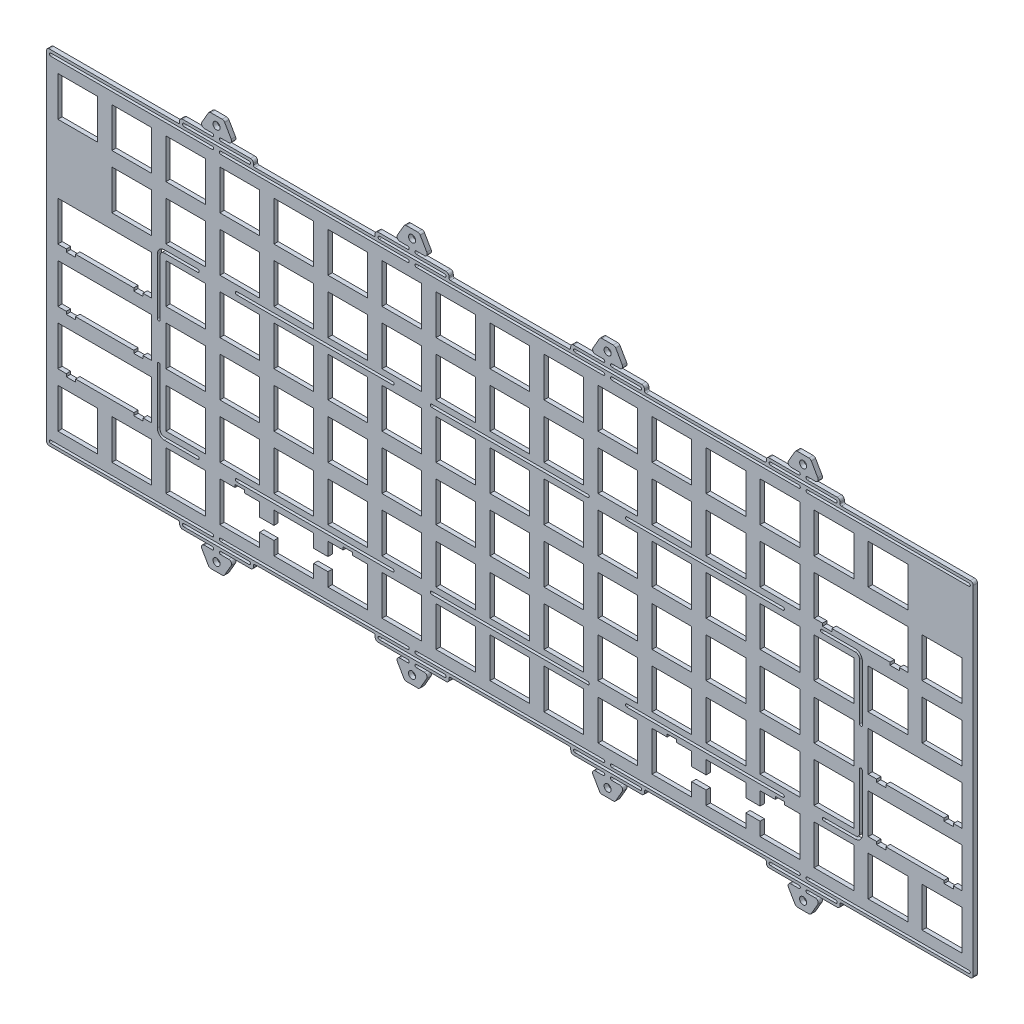
from build123d import *

# Parameters (mm, degrees)
SKETCH2_W                             = 344.79935
SKETCH2_H                             = 139.24936
SKETCH2_W_2                           = 13.999
SKETCH2_H_2                           = 14.00086
SKETCH2_W_3                           = 14.001
SKETCH2_W_4                           = 13.9993
SKETCH2_W_5                           = 13.99955
SKETCH2_H_3                           = 13.9994
SKETCH2_W_6                           = 14.0007
SKETCH2_H_4                           = 13.9993
SKETCH2_H_5                           = 13.9992
BOSS_EXTRUDE1_DEPTH                   = 1.524
SKETCH3_W                             = 388.73179045
SKETCH3_H                             = 165.989329794
CUT_EXTRUDE1_DEPTH                    = 186.935149558
TAP_DRILL_FOR_M3X0_5_TAP1_D           = 2.5
TAP_DRILL_FOR_M3X0_5_TAP1_DEPTH       = 7
TAP_DRILL_FOR_M3X0_5_TAP1_CSINK_D     = 2.55
TAP_DRILL_FOR_M3X0_5_TAP1_CSINK_ANGLE = 90
TAP_DRILL_FOR_M3X0_5_TAP1_TIP         = 0.751075774


with BuildPart() as part:
    # Sketch2 → Boss-Extrude1 (new body)
    with BuildSketch(Plane.XY):
        with Locations((-0.0007173, 0.0004735)):
            Rectangle(SKETCH2_W, SKETCH2_H)
        Polygon((102.2489577, -54.6242065), (102.2489577, -40.6233465), (96.8999577, -40.6233465), (96.8999577, -39.6545865), (93.5999577, -39.6545865), (93.5999577, -40.6233465), (88.2499577, -40.6233465), (88.2499577, -45.3238165), (83.1989577, -45.3238165), (83.1989577, -40.6233465), (69.1999577, -40.6233465), (69.1999577, -45.3238165), (64.1489577, -45.3238165), (64.1489577, -40.6233465), (58.8009577, -40.6233465), (58.8009577, -39.6545865), (55.4999577, -39.6545865), (55.4999577, -40.6233465), (50.1499577, -40.6233465), (50.1499577, -54.6242065), (64.1489577, -54.6242065), (64.1489577, -49.9223065), (69.1999577, -49.9223065), (69.1999577, -54.6242065), (83.1989577, -54.6242065), (83.1989577, -49.9223065), (88.2499577, -49.9223065), (88.2499577, -54.6242065), align=None, mode=Mode.SUBTRACT)
        Polygon((-50.1496423, -54.6242065), (-50.1496423, -40.6233465), (-55.4991423, -40.6233465), (-55.4991423, -39.6545865), (-58.7994423, -39.6545865), (-58.7994423, -40.6233465), (-64.1503423, -40.6233465), (-64.1503423, -45.3238165), (-69.2010423, -45.3238165), (-69.2010423, -40.6233465), (-83.2003423, -40.6233465), (-83.2003423, -45.3238165), (-88.2496423, -45.3238165), (-88.2496423, -40.6233465), (-93.6003423, -40.6233465), (-93.6003423, -39.6545865), (-96.9003423, -39.6545865), (-96.9003423, -40.6233465), (-102.2503423, -40.6233465), (-102.2503423, -54.6242065), (-88.2496423, -54.6242065), (-88.2496423, -49.9223065), (-83.2003423, -49.9223065), (-83.2003423, -54.6242065), (-69.2010423, -54.6242065), (-69.2010423, -49.9223065), (-64.1503423, -49.9223065), (-64.1503423, -54.6242065), align=None, mode=Mode.SUBTRACT)
        with Locations((152.3994577, -47.6237765)):
            Rectangle(SKETCH2_W_2, SKETCH2_H_2, mode=Mode.SUBTRACT)
        with Locations((133.3494577, -47.6237765)):
            Rectangle(SKETCH2_W_2, SKETCH2_H_2, mode=Mode.SUBTRACT)
        with Locations((114.2994577, -47.6237765)):
            Rectangle(SKETCH2_W_2, SKETCH2_H_2, mode=Mode.SUBTRACT)
        with Locations((38.0994577, -47.6237765)):
            Rectangle(SKETCH2_W_2, SKETCH2_H_2, mode=Mode.SUBTRACT)
        with Locations((19.0494577, -47.6237765)):
            Rectangle(SKETCH2_W_2, SKETCH2_H_2, mode=Mode.SUBTRACT)
        with Locations((-0.0005423, -47.6237765)):
            Rectangle(SKETCH2_W_2, SKETCH2_H_2, mode=Mode.SUBTRACT)
        with Locations((-19.0505423, -47.6237765)):
            Rectangle(SKETCH2_W_2, SKETCH2_H_2, mode=Mode.SUBTRACT)
        with Locations((-38.1015423, -47.6237765)):
            Rectangle(SKETCH2_W_3, SKETCH2_H_2, mode=Mode.SUBTRACT)
        with Locations((-114.3006923, -47.6237765)):
            Rectangle(SKETCH2_W_4, SKETCH2_H_2, mode=Mode.SUBTRACT)
        with Locations((-133.3506923, -47.6237765)):
            Rectangle(SKETCH2_W_4, SKETCH2_H_2, mode=Mode.SUBTRACT)
        with Locations((-152.4006173, -47.6237765)):
            Rectangle(SKETCH2_W_5, SKETCH2_H_2, mode=Mode.SUBTRACT)
        Polygon((126.3499577, -21.5748465), (126.3499577, -35.5742465), (129.3249577, -35.5742465), (129.3249577, -36.5443465), (132.6239577, -36.5443465), (132.6239577, -35.5742465), (153.1249577, -35.5742465), (153.1249577, -36.5443465), (156.4239577, -36.5443465), (156.4239577, -35.5742465), (159.3989577, -35.5742465), (159.3989577, -21.5748465), align=None, mode=Mode.SUBTRACT)
        Polygon((-159.4003923, -21.5748465), (-159.4003923, -35.5742465), (-156.4252023, -35.5742465), (-156.4252023, -36.5443465), (-153.1262023, -36.5443465), (-153.1262023, -35.5742465), (-132.6251423, -35.5742465), (-132.6251423, -36.5443465), (-129.3260423, -36.5443465), (-129.3260423, -35.5742465), (-126.3510423, -35.5742465), (-126.3510423, -21.5748465), align=None, mode=Mode.SUBTRACT)
        with Locations((114.2994577, -28.5745465)):
            Rectangle(SKETCH2_W_2, SKETCH2_H_3, mode=Mode.SUBTRACT)
        with Locations((95.2494577, -28.5745465)):
            Rectangle(SKETCH2_W_2, SKETCH2_H_3, mode=Mode.SUBTRACT)
        with Locations((76.1994577, -28.5745465)):
            Rectangle(SKETCH2_W_2, SKETCH2_H_3, mode=Mode.SUBTRACT)
        with Locations((57.1494577, -28.5745465)):
            Rectangle(SKETCH2_W_2, SKETCH2_H_3, mode=Mode.SUBTRACT)
        with Locations((38.0994577, -28.5745465)):
            Rectangle(SKETCH2_W_2, SKETCH2_H_3, mode=Mode.SUBTRACT)
        with Locations((19.0494577, -28.5745465)):
            Rectangle(SKETCH2_W_2, SKETCH2_H_3, mode=Mode.SUBTRACT)
        with Locations((-0.0005423, -28.5745465)):
            Rectangle(SKETCH2_W_2, SKETCH2_H_3, mode=Mode.SUBTRACT)
        with Locations((-19.0505423, -28.5745465)):
            Rectangle(SKETCH2_W_2, SKETCH2_H_3, mode=Mode.SUBTRACT)
        with Locations((-38.1015423, -28.5745465)):
            Rectangle(SKETCH2_W_3, SKETCH2_H_3, mode=Mode.SUBTRACT)
        with Locations((-57.1513923, -28.5745465)):
            Rectangle(SKETCH2_W_6, SKETCH2_H_3, mode=Mode.SUBTRACT)
        with Locations((-76.2006923, -28.5745465)):
            Rectangle(SKETCH2_W_4, SKETCH2_H_3, mode=Mode.SUBTRACT)
        with Locations((-95.2506923, -28.5745465)):
            Rectangle(SKETCH2_W_4, SKETCH2_H_3, mode=Mode.SUBTRACT)
        with Locations((-114.3006923, -28.5745465)):
            Rectangle(SKETCH2_W_4, SKETCH2_H_3, mode=Mode.SUBTRACT)
        Polygon((126.3499577, -2.5247465), (126.3499577, -16.5240465), (129.3249577, -16.5240465), (129.3249577, -17.4942465), (132.6239577, -17.4942465), (132.6239577, -16.5240465), (153.1249577, -16.5240465), (153.1249577, -17.4942465), (156.4239577, -17.4942465), (156.4239577, -16.5240465), (159.3989577, -16.5240465), (159.3989577, -2.5247465), align=None, mode=Mode.SUBTRACT)
        Polygon((-159.4003923, -2.5247465), (-159.4003923, -16.5240465), (-156.4252023, -16.5240465), (-156.4252023, -17.4942465), (-153.1262023, -17.4942465), (-153.1262023, -16.5240465), (-132.6251423, -16.5240465), (-132.6251423, -17.4942465), (-129.3260423, -17.4942465), (-129.3260423, -16.5240465), (-126.3510423, -16.5240465), (-126.3510423, -2.5247465), align=None, mode=Mode.SUBTRACT)
        with Locations((114.2994577, -9.5243965)):
            Rectangle(SKETCH2_W_2, SKETCH2_H_4, mode=Mode.SUBTRACT)
        with Locations((95.2494577, -9.5243965)):
            Rectangle(SKETCH2_W_2, SKETCH2_H_4, mode=Mode.SUBTRACT)
        with Locations((76.1994577, -9.5243965)):
            Rectangle(SKETCH2_W_2, SKETCH2_H_4, mode=Mode.SUBTRACT)
        with Locations((57.1494577, -9.5243965)):
            Rectangle(SKETCH2_W_2, SKETCH2_H_4, mode=Mode.SUBTRACT)
        with Locations((38.0994577, -9.5243965)):
            Rectangle(SKETCH2_W_2, SKETCH2_H_4, mode=Mode.SUBTRACT)
        with Locations((19.0494577, -9.5243965)):
            Rectangle(SKETCH2_W_2, SKETCH2_H_4, mode=Mode.SUBTRACT)
        with Locations((-0.0005423, -9.5243965)):
            Rectangle(SKETCH2_W_2, SKETCH2_H_4, mode=Mode.SUBTRACT)
        with Locations((-19.0505423, -9.5243965)):
            Rectangle(SKETCH2_W_2, SKETCH2_H_4, mode=Mode.SUBTRACT)
        with Locations((-38.1015423, -9.5243965)):
            Rectangle(SKETCH2_W_3, SKETCH2_H_4, mode=Mode.SUBTRACT)
        with Locations((-57.1513923, -9.5243965)):
            Rectangle(SKETCH2_W_6, SKETCH2_H_4, mode=Mode.SUBTRACT)
        with Locations((-76.2006923, -9.5243965)):
            Rectangle(SKETCH2_W_4, SKETCH2_H_4, mode=Mode.SUBTRACT)
        with Locations((-95.2506923, -9.5243965)):
            Rectangle(SKETCH2_W_4, SKETCH2_H_4, mode=Mode.SUBTRACT)
        with Locations((-114.3006923, -9.5243965)):
            Rectangle(SKETCH2_W_4, SKETCH2_H_4, mode=Mode.SUBTRACT)
        Polygon((-159.4003923, 16.5252535), (-159.4003923, 2.5259535), (-156.4252023, 2.5259535), (-156.4252023, 1.5557535), (-153.1262023, 1.5557535), (-153.1262023, 2.5259535), (-132.6251423, 2.5259535), (-132.6251423, 1.5557535), (-129.3260423, 1.5557535), (-129.3260423, 2.5259535), (-126.3510423, 2.5259535), (-126.3510423, 16.5252535), align=None, mode=Mode.SUBTRACT)
        with Locations((152.3994577, 9.5256035)):
            Rectangle(SKETCH2_W_2, SKETCH2_H_4, mode=Mode.SUBTRACT)
        with Locations((133.3494577, 9.5256035)):
            Rectangle(SKETCH2_W_2, SKETCH2_H_4, mode=Mode.SUBTRACT)
        with Locations((114.2994577, 9.5256035)):
            Rectangle(SKETCH2_W_2, SKETCH2_H_4, mode=Mode.SUBTRACT)
        with Locations((95.2494577, 9.5256035)):
            Rectangle(SKETCH2_W_2, SKETCH2_H_4, mode=Mode.SUBTRACT)
        with Locations((76.1994577, 9.5256035)):
            Rectangle(SKETCH2_W_2, SKETCH2_H_4, mode=Mode.SUBTRACT)
        with Locations((57.1494577, 9.5256035)):
            Rectangle(SKETCH2_W_2, SKETCH2_H_4, mode=Mode.SUBTRACT)
        with Locations((38.0994577, 9.5256035)):
            Rectangle(SKETCH2_W_2, SKETCH2_H_4, mode=Mode.SUBTRACT)
        with Locations((19.0494577, 9.5256035)):
            Rectangle(SKETCH2_W_2, SKETCH2_H_4, mode=Mode.SUBTRACT)
        with Locations((-0.0005423, 9.5256035)):
            Rectangle(SKETCH2_W_2, SKETCH2_H_4, mode=Mode.SUBTRACT)
        with Locations((-19.0505423, 9.5256035)):
            Rectangle(SKETCH2_W_2, SKETCH2_H_4, mode=Mode.SUBTRACT)
        with Locations((-38.1015423, 9.5256035)):
            Rectangle(SKETCH2_W_3, SKETCH2_H_4, mode=Mode.SUBTRACT)
        with Locations((-57.1513923, 9.5256035)):
            Rectangle(SKETCH2_W_6, SKETCH2_H_4, mode=Mode.SUBTRACT)
        with Locations((-76.2006923, 9.5256035)):
            Rectangle(SKETCH2_W_4, SKETCH2_H_4, mode=Mode.SUBTRACT)
        with Locations((-95.2506923, 9.5256035)):
            Rectangle(SKETCH2_W_4, SKETCH2_H_4, mode=Mode.SUBTRACT)
        with Locations((-114.3006923, 9.5256035)):
            Rectangle(SKETCH2_W_4, SKETCH2_H_4, mode=Mode.SUBTRACT)
        Polygon((107.2999577, 35.5752535), (107.2999577, 21.5759535), (110.2749577, 21.5759535), (110.2749577, 20.6057535), (113.5739577, 20.6057535), (113.5739577, 21.5759535), (134.0749577, 21.5759535), (134.0749577, 20.6057535), (137.3739577, 20.6057535), (137.3739577, 21.5759535), (140.3489577, 21.5759535), (140.3489577, 35.5752535), align=None, mode=Mode.SUBTRACT)
        with Locations((152.3994577, 28.5756035)):
            Rectangle(SKETCH2_W_2, SKETCH2_H_4, mode=Mode.SUBTRACT)
        with Locations((95.2494577, 28.5756035)):
            Rectangle(SKETCH2_W_2, SKETCH2_H_4, mode=Mode.SUBTRACT)
        with Locations((76.1994577, 28.5756035)):
            Rectangle(SKETCH2_W_2, SKETCH2_H_4, mode=Mode.SUBTRACT)
        with Locations((57.1494577, 28.5756035)):
            Rectangle(SKETCH2_W_2, SKETCH2_H_4, mode=Mode.SUBTRACT)
        with Locations((38.0994577, 28.5756035)):
            Rectangle(SKETCH2_W_2, SKETCH2_H_4, mode=Mode.SUBTRACT)
        with Locations((19.0494577, 28.5756035)):
            Rectangle(SKETCH2_W_2, SKETCH2_H_4, mode=Mode.SUBTRACT)
        with Locations((-0.0005423, 28.5756035)):
            Rectangle(SKETCH2_W_2, SKETCH2_H_4, mode=Mode.SUBTRACT)
        with Locations((-19.0505423, 28.5756035)):
            Rectangle(SKETCH2_W_2, SKETCH2_H_4, mode=Mode.SUBTRACT)
        with Locations((-38.1015423, 28.5756035)):
            Rectangle(SKETCH2_W_3, SKETCH2_H_4, mode=Mode.SUBTRACT)
        with Locations((-57.1513923, 28.5756035)):
            Rectangle(SKETCH2_W_6, SKETCH2_H_4, mode=Mode.SUBTRACT)
        with Locations((-76.2006923, 28.5756035)):
            Rectangle(SKETCH2_W_4, SKETCH2_H_4, mode=Mode.SUBTRACT)
        with Locations((-95.2506923, 28.5756035)):
            Rectangle(SKETCH2_W_4, SKETCH2_H_4, mode=Mode.SUBTRACT)
        with Locations((-114.3006923, 28.5756035)):
            Rectangle(SKETCH2_W_4, SKETCH2_H_4, mode=Mode.SUBTRACT)
        with Locations((-133.3506923, 28.5756035)):
            Rectangle(SKETCH2_W_4, SKETCH2_H_4, mode=Mode.SUBTRACT)
        with Locations((133.3494577, 47.6255535)):
            Rectangle(SKETCH2_W_2, SKETCH2_H_5, mode=Mode.SUBTRACT)
        with Locations((114.2994577, 47.6255535)):
            Rectangle(SKETCH2_W_2, SKETCH2_H_5, mode=Mode.SUBTRACT)
        with Locations((95.2494577, 47.6255535)):
            Rectangle(SKETCH2_W_2, SKETCH2_H_5, mode=Mode.SUBTRACT)
        with Locations((76.1994577, 47.6255535)):
            Rectangle(SKETCH2_W_2, SKETCH2_H_5, mode=Mode.SUBTRACT)
        with Locations((57.1494577, 47.6255535)):
            Rectangle(SKETCH2_W_2, SKETCH2_H_5, mode=Mode.SUBTRACT)
        with Locations((38.0994577, 47.6255535)):
            Rectangle(SKETCH2_W_2, SKETCH2_H_5, mode=Mode.SUBTRACT)
        with Locations((19.0494577, 47.6255535)):
            Rectangle(SKETCH2_W_2, SKETCH2_H_5, mode=Mode.SUBTRACT)
        with Locations((-0.0005423, 47.6255535)):
            Rectangle(SKETCH2_W_2, SKETCH2_H_5, mode=Mode.SUBTRACT)
        with Locations((-19.0505423, 47.6255535)):
            Rectangle(SKETCH2_W_2, SKETCH2_H_5, mode=Mode.SUBTRACT)
        with Locations((-38.1015423, 47.6255535)):
            Rectangle(SKETCH2_W_3, SKETCH2_H_5, mode=Mode.SUBTRACT)
        with Locations((-57.1513923, 47.6255535)):
            Rectangle(SKETCH2_W_6, SKETCH2_H_5, mode=Mode.SUBTRACT)
        with Locations((-76.2006923, 47.6255535)):
            Rectangle(SKETCH2_W_4, SKETCH2_H_5, mode=Mode.SUBTRACT)
        with Locations((-95.2506923, 47.6255535)):
            Rectangle(SKETCH2_W_4, SKETCH2_H_5, mode=Mode.SUBTRACT)
        with Locations((-114.3006923, 47.6255535)):
            Rectangle(SKETCH2_W_4, SKETCH2_H_5, mode=Mode.SUBTRACT)
        with Locations((-133.3506923, 47.6255535)):
            Rectangle(SKETCH2_W_4, SKETCH2_H_5, mode=Mode.SUBTRACT)
        with Locations((-152.4006173, 47.6255535)):
            Rectangle(SKETCH2_W_5, SKETCH2_H_5, mode=Mode.SUBTRACT)
    extrude(amount=BOSS_EXTRUDE1_DEPTH)

    # Sketch3 → Cut-Extrude1 (cut, through all)
    # profile 1 of 29: a face of its own
    with BuildSketch(Plane.XY.offset(1.524)):
        Rectangle(SKETCH3_W, SKETCH3_H)
        with BuildLine():
            ThreePointArc((-105.4405223, -69.6242065), (-105.9405223, -69.490231904), (-106.306547704, -69.1242065))
            Line((-106.306547704, -69.1242065), (-108.615948781, -65.1242065))
            ThreePointArc((-108.615948781, -65.1242065), (-108.615948781, -64.1242065), (-107.749923377, -63.6242065))
            Line((-107.749923377, -63.6242065), (-104.9405223, -63.6242065))
            ThreePointArc((-104.9405223, -63.6242065), (-104.4405223, -63.1242065), (-104.9405223, -62.6242065))
            Line((-104.9405223, -62.6242065), (-115.4405223, -62.6242065))
            ThreePointArc((-115.4405223, -62.6242065), (-116.147629081, -62.331313281), (-116.4405223, -61.6242065))
            Line((-116.4405223, -61.6242065), (-116.4405223, -61.1241965))
            ThreePointArc((-116.4405223, -61.1241965), (-116.58696598, -60.77065018), (-116.9405123, -60.6242065))
            Line((-116.9405123, -60.6242065), (-162.4003923, -60.6242065))
            ThreePointArc((-162.4003923, -60.6242065), (-163.107499081, -60.331313281), (-163.4003923, -59.6242065))
            Line((-163.4003923, -59.6242065), (-163.4003923, 59.6242065))
            ThreePointArc((-163.4003923, 59.6242065), (-163.107499081, 60.331313281), (-162.4003923, 60.6242065))
            Line((-162.4003923, 60.6242065), (-116.9405123, 60.6242065))
            ThreePointArc((-116.9405123, 60.6242065), (-116.58696598, 60.77065018), (-116.4405223, 61.1241965))
            Line((-116.4405223, 61.1241965), (-116.4405223, 61.6242065))
            ThreePointArc((-116.4405223, 61.6242065), (-116.147629081, 62.331313281), (-115.4405223, 62.6242065))
            Line((-115.4405223, 62.6242065), (-104.9405223, 62.6242065))
            ThreePointArc((-104.9405223, 62.6242065), (-104.4405223, 63.1242065), (-104.9405223, 63.6242065))
            Line((-104.9405223, 63.6242065), (-107.749923377, 63.6242065))
            ThreePointArc((-107.749923377, 63.6242065), (-108.615948781, 64.1242065), (-108.615948781, 65.1242065))
            Line((-108.615948781, 65.1242065), (-106.306547704, 69.1242065))
            ThreePointArc((-106.306547704, 69.1242065), (-105.9405223, 69.490231904), (-105.4405223, 69.6242065))
            Line((-105.4405223, 69.6242065), (-101.4405223, 69.6242065))
            ThreePointArc((-101.4405223, 69.6242065), (-100.9405223, 69.490231904), (-100.574496896, 69.1242065))
            Line((-100.574496896, 69.1242065), (-98.265095819, 65.1242065))
            ThreePointArc((-98.265095819, 65.1242065), (-98.265095819, 64.1242065), (-99.131121223, 63.6242065))
            Line((-99.131121223, 63.6242065), (-101.9405223, 63.6242065))
            ThreePointArc((-101.9405223, 63.6242065), (-102.4405223, 63.1242065), (-101.9405223, 62.6242065))
            Line((-101.9405223, 62.6242065), (-91.4405223, 62.6242065))
            ThreePointArc((-91.4405223, 62.6242065), (-90.733415519, 62.331313281), (-90.4405223, 61.6242065))
            Line((-90.4405223, 61.6242065), (-90.4405223, 61.1241965))
            ThreePointArc((-90.4405223, 61.1241965), (-90.29407862, 60.77065018), (-89.9405323, 60.6242065))
            Line((-89.9405323, 60.6242065), (-47.9806423, 60.6242065))
            ThreePointArc((-47.9806423, 60.6242065), (-47.62709598, 60.77065018), (-47.4806523, 61.1241965))
            Line((-47.4806523, 61.1241965), (-47.4806523, 61.6242065))
            ThreePointArc((-47.4806523, 61.6242065), (-47.187759081, 62.331313281), (-46.4806523, 62.6242065))
            Line((-46.4806523, 62.6242065), (-35.9806523, 62.6242065))
            ThreePointArc((-35.9806523, 62.6242065), (-35.4806523, 63.1242065), (-35.9806523, 63.6242065))
            Line((-35.9806523, 63.6242065), (-38.790053377, 63.6242065))
            ThreePointArc((-38.790053377, 63.6242065), (-39.656078781, 64.1242065), (-39.656078781, 65.1242065))
            Line((-39.656078781, 65.1242065), (-37.346677704, 69.1242065))
            ThreePointArc((-37.346677704, 69.1242065), (-36.9806523, 69.490231904), (-36.4806523, 69.6242065))
            Line((-36.4806523, 69.6242065), (-32.4806523, 69.6242065))
            ThreePointArc((-32.4806523, 69.6242065), (-31.9806523, 69.490231904), (-31.614626896, 69.1242065))
            Line((-31.614626896, 69.1242065), (-29.305225819, 65.1242065))
            ThreePointArc((-29.305225819, 65.1242065), (-29.305225819, 64.1242065), (-30.171251223, 63.6242065))
            Line((-30.171251223, 63.6242065), (-32.9806523, 63.6242065))
            ThreePointArc((-32.9806523, 63.6242065), (-33.4806523, 63.1242065), (-32.9806523, 62.6242065))
            Line((-32.9806523, 62.6242065), (-22.4806523, 62.6242065))
            ThreePointArc((-22.4806523, 62.6242065), (-21.773545519, 62.331313281), (-21.4806523, 61.6242065))
            Line((-21.4806523, 61.6242065), (-21.4806523, 61.1241965))
            ThreePointArc((-21.4806523, 61.1241965), (-21.33420862, 60.77065018), (-20.9806623, 60.6242065))
            Line((-20.9806623, 60.6242065), (20.9792277, 60.6242065))
            ThreePointArc((20.9792277, 60.6242065), (21.33277402, 60.77065018), (21.4792177, 61.1241965))
            Line((21.4792177, 61.1241965), (21.4792177, 61.6242065))
            ThreePointArc((21.4792177, 61.6242065), (21.772110919, 62.331313281), (22.4792177, 62.6242065))
            Line((22.4792177, 62.6242065), (32.9792177, 62.6242065))
            ThreePointArc((32.9792177, 62.6242065), (33.4792177, 63.1242065), (32.9792177, 63.6242065))
            Line((32.9792177, 63.6242065), (30.169816623, 63.6242065))
            ThreePointArc((30.169816623, 63.6242065), (29.303791219, 64.1242065), (29.303791219, 65.1242065))
            Line((29.303791219, 65.1242065), (31.613192296, 69.1242065))
            ThreePointArc((31.613192296, 69.1242065), (31.9792177, 69.490231904), (32.4792177, 69.6242065))
            Line((32.4792177, 69.6242065), (36.4792177, 69.6242065))
            ThreePointArc((36.4792177, 69.6242065), (36.9792177, 69.490231904), (37.345243104, 69.1242065))
            Line((37.345243104, 69.1242065), (39.654644181, 65.1242065))
            ThreePointArc((39.654644181, 65.1242065), (39.654644181, 64.1242065), (38.788618777, 63.6242065))
            Line((38.788618777, 63.6242065), (35.9792177, 63.6242065))
            ThreePointArc((35.9792177, 63.6242065), (35.4792177, 63.1242065), (35.9792177, 62.6242065))
            Line((35.9792177, 62.6242065), (46.4792177, 62.6242065))
            ThreePointArc((46.4792177, 62.6242065), (47.186324481, 62.331313281), (47.4792177, 61.6242065))
            Line((47.4792177, 61.6242065), (47.4792177, 61.1241965))
            ThreePointArc((47.4792177, 61.1241965), (47.62566138, 60.77065018), (47.9792077, 60.6242065))
            Line((47.9792077, 60.6242065), (89.9390977, 60.6242065))
            ThreePointArc((89.9390977, 60.6242065), (90.29264402, 60.77065018), (90.4390877, 61.1241965))
            Line((90.4390877, 61.1241965), (90.4390877, 61.6242065))
            ThreePointArc((90.4390877, 61.6242065), (90.731980919, 62.331313281), (91.4390877, 62.6242065))
            Line((91.4390877, 62.6242065), (101.9390877, 62.6242065))
            ThreePointArc((101.9390877, 62.6242065), (102.4390877, 63.1242065), (101.9390877, 63.6242065))
            Line((101.9390877, 63.6242065), (99.129686623, 63.6242065))
            ThreePointArc((99.129686623, 63.6242065), (98.263661219, 64.1242065), (98.263661219, 65.1242065))
            Line((98.263661219, 65.1242065), (100.573062296, 69.1242065))
            ThreePointArc((100.573062296, 69.1242065), (100.9390877, 69.490231904), (101.4390877, 69.6242065))
            Line((101.4390877, 69.6242065), (105.4390877, 69.6242065))
            ThreePointArc((105.4390877, 69.6242065), (105.9390877, 69.490231904), (106.305113104, 69.1242065))
            Line((106.305113104, 69.1242065), (108.614514181, 65.1242065))
            ThreePointArc((108.614514181, 65.1242065), (108.614514181, 64.1242065), (107.748488777, 63.6242065))
            Line((107.748488777, 63.6242065), (104.9390877, 63.6242065))
            ThreePointArc((104.9390877, 63.6242065), (104.4390877, 63.1242065), (104.9390877, 62.6242065))
            Line((104.9390877, 62.6242065), (115.4390877, 62.6242065))
            ThreePointArc((115.4390877, 62.6242065), (116.146194481, 62.331313281), (116.4390877, 61.6242065))
            Line((116.4390877, 61.6242065), (116.4390877, 61.1241965))
            ThreePointArc((116.4390877, 61.1241965), (116.58553138, 60.77065018), (116.9390777, 60.6242065))
            Line((116.9390777, 60.6242065), (162.3989577, 60.6242065))
            ThreePointArc((162.3989577, 60.6242065), (163.106064481, 60.331313281), (163.3989577, 59.6242065))
            Line((163.3989577, 59.6242065), (163.3989577, -59.6242065))
            ThreePointArc((163.3989577, -59.6242065), (163.106064481, -60.331313281), (162.3989577, -60.6242065))
            Line((162.3989577, -60.6242065), (116.9390777, -60.6242065))
            ThreePointArc((116.9390777, -60.6242065), (116.58553138, -60.77065018), (116.4390877, -61.1241965))
            Line((116.4390877, -61.1241965), (116.4390877, -61.6242065))
            ThreePointArc((116.4390877, -61.6242065), (116.146194481, -62.331313281), (115.4390877, -62.6242065))
            Line((115.4390877, -62.6242065), (104.9390877, -62.6242065))
            ThreePointArc((104.9390877, -62.6242065), (104.4390877, -63.1242065), (104.9390877, -63.6242065))
            Line((104.9390877, -63.6242065), (107.748488777, -63.6242065))
            ThreePointArc((107.748488777, -63.6242065), (108.614514181, -64.1242065), (108.614514181, -65.1242065))
            Line((108.614514181, -65.1242065), (106.305113104, -69.1242065))
            ThreePointArc((106.305113104, -69.1242065), (105.9390877, -69.490231904), (105.4390877, -69.6242065))
            Line((105.4390877, -69.6242065), (101.4390877, -69.6242065))
            ThreePointArc((101.4390877, -69.6242065), (100.9390877, -69.490231904), (100.573062296, -69.1242065))
            Line((100.573062296, -69.1242065), (98.263661219, -65.1242065))
            ThreePointArc((98.263661219, -65.1242065), (98.263661219, -64.1242065), (99.129686623, -63.6242065))
            Line((99.129686623, -63.6242065), (101.9390877, -63.6242065))
            ThreePointArc((101.9390877, -63.6242065), (102.4390877, -63.1242065), (101.9390877, -62.6242065))
            Line((101.9390877, -62.6242065), (91.4390877, -62.6242065))
            ThreePointArc((91.4390877, -62.6242065), (90.731980919, -62.331313281), (90.4390877, -61.6242065))
            Line((90.4390877, -61.6242065), (90.4390877, -61.1241965))
            ThreePointArc((90.4390877, -61.1241965), (90.29264402, -60.77065018), (89.9390977, -60.6242065))
            Line((89.9390977, -60.6242065), (47.9792077, -60.6242065))
            ThreePointArc((47.9792077, -60.6242065), (47.62566138, -60.77065018), (47.4792177, -61.1241965))
            Line((47.4792177, -61.1241965), (47.4792177, -61.6242065))
            ThreePointArc((47.4792177, -61.6242065), (47.186324481, -62.331313281), (46.4792177, -62.6242065))
            Line((46.4792177, -62.6242065), (35.9792177, -62.6242065))
            ThreePointArc((35.9792177, -62.6242065), (35.4792177, -63.1242065), (35.9792177, -63.6242065))
            Line((35.9792177, -63.6242065), (38.788618777, -63.6242065))
            ThreePointArc((38.788618777, -63.6242065), (39.654644181, -64.1242065), (39.654644181, -65.1242065))
            Line((39.654644181, -65.1242065), (37.345243104, -69.1242065))
            ThreePointArc((37.345243104, -69.1242065), (36.9792177, -69.490231904), (36.4792177, -69.6242065))
            Line((36.4792177, -69.6242065), (32.4792177, -69.6242065))
            ThreePointArc((32.4792177, -69.6242065), (31.9792177, -69.490231904), (31.613192296, -69.1242065))
            Line((31.613192296, -69.1242065), (29.303791219, -65.1242065))
            ThreePointArc((29.303791219, -65.1242065), (29.303791219, -64.1242065), (30.169816623, -63.6242065))
            Line((30.169816623, -63.6242065), (32.9792177, -63.6242065))
            ThreePointArc((32.9792177, -63.6242065), (33.4792177, -63.1242065), (32.9792177, -62.6242065))
            Line((32.9792177, -62.6242065), (22.4792177, -62.6242065))
            ThreePointArc((22.4792177, -62.6242065), (21.772110919, -62.331313281), (21.4792177, -61.6242065))
            Line((21.4792177, -61.6242065), (21.4792177, -61.1241965))
            ThreePointArc((21.4792177, -61.1241965), (21.33277402, -60.77065018), (20.9792277, -60.6242065))
            Line((20.9792277, -60.6242065), (-20.9806623, -60.6242065))
            ThreePointArc((-20.9806623, -60.6242065), (-21.33420862, -60.77065018), (-21.4806523, -61.1241965))
            Line((-21.4806523, -61.1241965), (-21.4806523, -61.6242065))
            ThreePointArc((-21.4806523, -61.6242065), (-21.773545519, -62.331313281), (-22.4806523, -62.6242065))
            Line((-22.4806523, -62.6242065), (-32.9806523, -62.6242065))
            ThreePointArc((-32.9806523, -62.6242065), (-33.4806523, -63.1242065), (-32.9806523, -63.6242065))
            Line((-32.9806523, -63.6242065), (-30.171251223, -63.6242065))
            ThreePointArc((-30.171251223, -63.6242065), (-29.305225819, -64.1242065), (-29.305225819, -65.1242065))
            Line((-29.305225819, -65.1242065), (-31.614626896, -69.1242065))
            ThreePointArc((-31.614626896, -69.1242065), (-31.9806523, -69.490231904), (-32.4806523, -69.6242065))
            Line((-32.4806523, -69.6242065), (-36.4806523, -69.6242065))
            ThreePointArc((-36.4806523, -69.6242065), (-36.9806523, -69.490231904), (-37.346677704, -69.1242065))
            Line((-37.346677704, -69.1242065), (-39.656078781, -65.1242065))
            ThreePointArc((-39.656078781, -65.1242065), (-39.656078781, -64.1242065), (-38.790053377, -63.6242065))
            Line((-38.790053377, -63.6242065), (-35.9806523, -63.6242065))
            ThreePointArc((-35.9806523, -63.6242065), (-35.4806523, -63.1242065), (-35.9806523, -62.6242065))
            Line((-35.9806523, -62.6242065), (-46.4806523, -62.6242065))
            ThreePointArc((-46.4806523, -62.6242065), (-47.187759081, -62.331313281), (-47.4806523, -61.6242065))
            Line((-47.4806523, -61.6242065), (-47.4806523, -61.1241965))
            ThreePointArc((-47.4806523, -61.1241965), (-47.62709598, -60.77065018), (-47.9806423, -60.6242065))
            Line((-47.9806423, -60.6242065), (-89.9405323, -60.6242065))
            ThreePointArc((-89.9405323, -60.6242065), (-90.29407862, -60.77065018), (-90.4405223, -61.1241965))
            Line((-90.4405223, -61.1241965), (-90.4405223, -61.6242065))
            ThreePointArc((-90.4405223, -61.6242065), (-90.733415519, -62.331313281), (-91.4405223, -62.6242065))
            Line((-91.4405223, -62.6242065), (-101.9405223, -62.6242065))
            ThreePointArc((-101.9405223, -62.6242065), (-102.4405223, -63.1242065), (-101.9405223, -63.6242065))
            Line((-101.9405223, -63.6242065), (-99.131121223, -63.6242065))
            ThreePointArc((-99.131121223, -63.6242065), (-98.265095819, -64.1242065), (-98.265095819, -65.1242065))
            Line((-98.265095819, -65.1242065), (-100.574496896, -69.1242065))
            ThreePointArc((-100.574496896, -69.1242065), (-100.9405223, -69.490231904), (-101.4405223, -69.6242065))
            Line((-101.4405223, -69.6242065), (-105.4405223, -69.6242065))
        make_face(mode=Mode.SUBTRACT)
    # profile 2 of 29: a face of its own
    with BuildSketch(Plane.XY.offset(1.524)):
        with BuildLine():
            Line((110.066116033, 18.5506035), (121.8244577, 18.5506035))
            ThreePointArc((121.8244577, 18.5506035), (122.885117872, 18.111263672), (123.3244577, 17.0506035))
            Line((123.3244577, 17.0506035), (123.3244577, -2.6440965))
            ThreePointArc((123.3244577, -2.6440965), (123.8244577, -3.1440965), (124.3244577, -2.6440965))
            Line((124.3244577, -2.6440965), (124.3244577, 17.0506035))
            ThreePointArc((124.3244577, 17.0506035), (123.592224653, 18.818370453), (121.8244577, 19.5506035))
            Line((121.8244577, 19.5506035), (110.066116033, 19.5506035))
            ThreePointArc((110.066116033, 19.5506035), (109.566116033, 19.0506035), (110.066116033, 18.5506035))
        make_face()
    # profile 3 of 29: a face of its own
    with BuildSketch(Plane.XY.offset(1.524)):
        with BuildLine():
            ThreePointArc((110.707542335, -37.5987965), (110.207542335, -38.0987965), (110.707542335, -38.5987965))
            Line((110.707542335, -38.5987965), (121.8244577, -38.5987965))
            ThreePointArc((121.8244577, -38.5987965), (123.592224653, -37.866563453), (124.3244577, -36.0987965))
            Line((124.3244577, -36.0987965), (124.3244577, -16.4040965))
            ThreePointArc((124.3244577, -16.4040965), (123.8244577, -15.9040965), (123.3244577, -16.4040965))
            Line((123.3244577, -16.4040965), (123.3244577, -36.0987965))
            ThreePointArc((123.3244577, -36.0987965), (122.885117872, -37.159456672), (121.8244577, -37.5987965))
            Line((121.8244577, -37.5987965), (110.707542335, -37.5987965))
        make_face()
    # profile 4 of 29: a face of its own
    with BuildSketch(Plane.XY.offset(1.524)):
        with BuildLine():
            ThreePointArc((-110.067350633, 18.5506035), (-109.567350633, 19.0506035), (-110.067350633, 19.5506035))
            Line((-110.067350633, 19.5506035), (-121.8256923, 19.5506035))
            ThreePointArc((-121.8256923, 19.5506035), (-123.593459253, 18.818370453), (-124.3256923, 17.0506035))
            Line((-124.3256923, 17.0506035), (-124.3256923, -2.6440965))
            ThreePointArc((-124.3256923, -2.6440965), (-123.8256923, -3.1440965), (-123.3256923, -2.6440965))
            Line((-123.3256923, -2.6440965), (-123.3256923, 17.0506035))
            ThreePointArc((-123.3256923, 17.0506035), (-122.886352472, 18.111263672), (-121.8256923, 18.5506035))
            Line((-121.8256923, 18.5506035), (-110.067350633, 18.5506035))
        make_face()
    # profile 5 of 29: a face of its own
    with BuildSketch(Plane.XY.offset(1.524)):
        with BuildLine():
            ThreePointArc((41.2744077, -37.5987965), (40.7744077, -38.0987965), (41.2744077, -38.5987965))
            Line((41.2744077, -38.5987965), (96.307774367, -38.5987965))
            ThreePointArc((96.307774367, -38.5987965), (96.807774367, -38.0987965), (96.307774367, -37.5987965))
            Line((96.307774367, -37.5987965), (41.2744077, -37.5987965))
        make_face()
    # profile 6 of 29: a face of its own
    with BuildSketch(Plane.XY.offset(1.524)):
        with BuildLine():
            ThreePointArc((-27.517300633, -37.5987965), (-28.017300633, -38.0987965), (-27.517300633, -38.5987965))
            Line((-27.517300633, -38.5987965), (27.516066033, -38.5987965))
            ThreePointArc((27.516066033, -38.5987965), (28.016066033, -38.0987965), (27.516066033, -37.5987965))
            Line((27.516066033, -37.5987965), (-27.517300633, -37.5987965))
        make_face()
    # profile 7 of 29: a face of its own
    with BuildSketch(Plane.XY.offset(1.524)):
        with BuildLine():
            ThreePointArc((-96.309008967, -37.5987965), (-96.809008967, -38.0987965), (-96.309008967, -38.5987965))
            Line((-96.309008967, -38.5987965), (-41.2756423, -38.5987965))
            ThreePointArc((-41.2756423, -38.5987965), (-40.7756423, -38.0987965), (-41.2756423, -37.5987965))
            Line((-41.2756423, -37.5987965), (-96.309008967, -37.5987965))
        make_face()
    # profile 8 of 29: a face of its own
    with BuildSketch(Plane.XY.offset(1.524)):
        with BuildLine():
            ThreePointArc((41.2744077, 19.5506035), (40.7744077, 19.0506035), (41.2744077, 18.5506035))
            Line((41.2744077, 18.5506035), (96.307774367, 18.5506035))
            ThreePointArc((96.307774367, 18.5506035), (96.807774367, 19.0506035), (96.307774367, 19.5506035))
            Line((96.307774367, 19.5506035), (41.2744077, 19.5506035))
        make_face()
    # profile 9 of 29: a face of its own
    with BuildSketch(Plane.XY.offset(1.524)):
        with BuildLine():
            ThreePointArc((-96.309008967, 19.5506035), (-96.809008967, 19.0506035), (-96.309008967, 18.5506035))
            Line((-96.309008967, 18.5506035), (-41.2756423, 18.5506035))
            ThreePointArc((-41.2756423, 18.5506035), (-40.7756423, 19.0506035), (-41.2756423, 19.5506035))
            Line((-41.2756423, 19.5506035), (-96.309008967, 19.5506035))
        make_face()
    # profile 10 of 29: a face of its own
    with BuildSketch(Plane.XY.offset(1.524)):
        with BuildLine():
            ThreePointArc((-27.517300633, 19.5506035), (-28.017300633, 19.0506035), (-27.517300633, 18.5506035))
            Line((-27.517300633, 18.5506035), (27.516066033, 18.5506035))
            ThreePointArc((27.516066033, 18.5506035), (28.016066033, 19.0506035), (27.516066033, 19.5506035))
            Line((27.516066033, 19.5506035), (-27.517300633, 19.5506035))
        make_face()
    # profile 11 of 29: a face of its own
    with BuildSketch(Plane.XY.offset(1.524)):
        with BuildLine():
            Line((-110.067350633, -37.5987965), (-121.8256923, -37.5987965))
            ThreePointArc((-121.8256923, -37.5987965), (-122.886352472, -37.159456672), (-123.3256923, -36.0987965))
            Line((-123.3256923, -36.0987965), (-123.3256923, -16.4040965))
            ThreePointArc((-123.3256923, -16.4040965), (-123.8256923, -15.9040965), (-124.3256923, -16.4040965))
            Line((-124.3256923, -16.4040965), (-124.3256923, -36.0987965))
            ThreePointArc((-124.3256923, -36.0987965), (-123.593459253, -37.866563453), (-121.8256923, -38.5987965))
            Line((-121.8256923, -38.5987965), (-110.067350633, -38.5987965))
            ThreePointArc((-110.067350633, -38.5987965), (-109.567350633, -38.0987965), (-110.067350633, -37.5987965))
        make_face()
    # profile 12 of 29: a face of its own
    with BuildSketch(Plane.XY.offset(1.524)):
        with BuildLine():
            ThreePointArc((-161.90456195, 59.6242065), (-162.40456195, 59.1242065), (-161.90456195, 58.6242065))
            Line((-161.90456195, 58.6242065), (-104.9405223, 58.6242065))
            ThreePointArc((-104.9405223, 58.6242065), (-104.4405223, 59.1242065), (-104.9405223, 59.6242065))
            Line((-104.9405223, 59.6242065), (-161.90456195, 59.6242065))
        make_face()
    # profile 13 of 29: a face of its own
    with BuildSketch(Plane.XY.offset(1.524)):
        with BuildLine():
            ThreePointArc((-101.9405223, 59.6242065), (-102.4405223, 59.1242065), (-101.9405223, 58.6242065))
            Line((-101.9405223, 58.6242065), (-35.9806523, 58.6242065))
            ThreePointArc((-35.9806523, 58.6242065), (-35.4806523, 59.1242065), (-35.9806523, 59.6242065))
            Line((-35.9806523, 59.6242065), (-101.9405223, 59.6242065))
        make_face()
    # profile 14 of 29: a face of its own
    with BuildSketch(Plane.XY.offset(1.524)):
        with BuildLine():
            Line((32.9792177, 59.6242065), (-32.9806523, 59.6242065))
            ThreePointArc((-32.9806523, 59.6242065), (-33.4806523, 59.1242065), (-32.9806523, 58.6242065))
            Line((-32.9806523, 58.6242065), (32.9792177, 58.6242065))
            ThreePointArc((32.9792177, 58.6242065), (33.4792177, 59.1242065), (32.9792177, 59.6242065))
        make_face()
    # profile 15 of 29: a face of its own
    with BuildSketch(Plane.XY.offset(1.524)):
        with BuildLine():
            Line((101.9390877, 59.6242065), (35.9792177, 59.6242065))
            ThreePointArc((35.9792177, 59.6242065), (35.4792177, 59.1242065), (35.9792177, 58.6242065))
            Line((35.9792177, 58.6242065), (101.9390877, 58.6242065))
            ThreePointArc((101.9390877, 58.6242065), (102.4390877, 59.1242065), (101.9390877, 59.6242065))
        make_face()
    # profile 16 of 29: a face of its own
    with BuildSketch(Plane.XY.offset(1.524)):
        with BuildLine():
            ThreePointArc((161.90312735, 58.6242065), (162.40312735, 59.1242065), (161.90312735, 59.6242065))
            Line((161.90312735, 59.6242065), (104.9390877, 59.6242065))
            ThreePointArc((104.9390877, 59.6242065), (104.4390877, 59.1242065), (104.9390877, 58.6242065))
            Line((104.9390877, 58.6242065), (161.90312735, 58.6242065))
        make_face()
    # profile 17 of 29: a face of its own
    with BuildSketch(Plane.XY.offset(1.524)):
        with BuildLine():
            ThreePointArc((161.90312735, -59.6242065), (162.40312735, -59.1242065), (161.90312735, -58.6242065))
            Line((161.90312735, -58.6242065), (104.9390877, -58.6242065))
            ThreePointArc((104.9390877, -58.6242065), (104.4390877, -59.1242065), (104.9390877, -59.6242065))
            Line((104.9390877, -59.6242065), (161.90312735, -59.6242065))
        make_face()
    # profile 18 of 29: a face of its own
    with BuildSketch(Plane.XY.offset(1.524)):
        with BuildLine():
            ThreePointArc((-161.90456195, -58.6242065), (-162.40456195, -59.1242065), (-161.90456195, -59.6242065))
            Line((-161.90456195, -59.6242065), (-104.9405223, -59.6242065))
            ThreePointArc((-104.9405223, -59.6242065), (-104.4405223, -59.1242065), (-104.9405223, -58.6242065))
            Line((-104.9405223, -58.6242065), (-161.90456195, -58.6242065))
        make_face()
    # profile 19 of 29: a face of its own
    with BuildSketch(Plane.XY.offset(1.524)):
        with BuildLine():
            Line((101.9390877, -58.6242065), (35.9792177, -58.6242065))
            ThreePointArc((35.9792177, -58.6242065), (35.4792177, -59.1242065), (35.9792177, -59.6242065))
            Line((35.9792177, -59.6242065), (101.9390877, -59.6242065))
            ThreePointArc((101.9390877, -59.6242065), (102.4390877, -59.1242065), (101.9390877, -58.6242065))
        make_face()
    # profile 20 of 29: a face of its own
    with BuildSketch(Plane.XY.offset(1.524)):
        with BuildLine():
            Line((32.9792177, -58.6242065), (-32.9806523, -58.6242065))
            ThreePointArc((-32.9806523, -58.6242065), (-33.4806523, -59.1242065), (-32.9806523, -59.6242065))
            Line((-32.9806523, -59.6242065), (32.9792177, -59.6242065))
            ThreePointArc((32.9792177, -59.6242065), (33.4792177, -59.1242065), (32.9792177, -58.6242065))
        make_face()
    # profile 21 of 29: a face of its own
    with BuildSketch(Plane.XY.offset(1.524)):
        with BuildLine():
            ThreePointArc((-101.9405223, -58.6242065), (-102.4405223, -59.1242065), (-101.9405223, -59.6242065))
            Line((-101.9405223, -59.6242065), (-35.9806523, -59.6242065))
            ThreePointArc((-35.9806523, -59.6242065), (-35.4806523, -59.1242065), (-35.9806523, -58.6242065))
            Line((-35.9806523, -58.6242065), (-101.9405223, -58.6242065))
        make_face()
    # profile 22 of 29: a face of its own
    with BuildSketch(Plane.XY.offset(1.524)):
        with BuildLine():
            ThreePointArc((-114.9405223, 61.6242065), (-115.4405223, 61.1242065), (-114.9405223, 60.6242065))
            Line((-114.9405223, 60.6242065), (-91.9405223, 60.6242065))
            ThreePointArc((-91.9405223, 60.6242065), (-91.4405223, 61.1242065), (-91.9405223, 61.6242065))
            Line((-91.9405223, 61.6242065), (-114.9405223, 61.6242065))
        make_face()
    # profile 23 of 29: a face of its own
    with BuildSketch(Plane.XY.offset(1.524)):
        with BuildLine():
            ThreePointArc((-45.9806523, 61.6242065), (-46.4806523, 61.1242065), (-45.9806523, 60.6242065))
            Line((-45.9806523, 60.6242065), (-22.9806523, 60.6242065))
            ThreePointArc((-22.9806523, 60.6242065), (-22.4806523, 61.1242065), (-22.9806523, 61.6242065))
            Line((-22.9806523, 61.6242065), (-45.9806523, 61.6242065))
        make_face()
    # profile 24 of 29: a face of its own
    with BuildSketch(Plane.XY.offset(1.524)):
        with BuildLine():
            ThreePointArc((22.9792177, 61.6242065), (22.4792177, 61.1242065), (22.9792177, 60.6242065))
            Line((22.9792177, 60.6242065), (45.9792177, 60.6242065))
            ThreePointArc((45.9792177, 60.6242065), (46.4792177, 61.1242065), (45.9792177, 61.6242065))
            Line((45.9792177, 61.6242065), (22.9792177, 61.6242065))
        make_face()
    # profile 25 of 29: a face of its own
    with BuildSketch(Plane.XY.offset(1.524)):
        with BuildLine():
            ThreePointArc((91.9390877, 61.6242065), (91.4390877, 61.1242065), (91.9390877, 60.6242065))
            Line((91.9390877, 60.6242065), (114.9390877, 60.6242065))
            ThreePointArc((114.9390877, 60.6242065), (115.4390877, 61.1242065), (114.9390877, 61.6242065))
            Line((114.9390877, 61.6242065), (91.9390877, 61.6242065))
        make_face()
    # profile 26 of 29: a face of its own
    with BuildSketch(Plane.XY.offset(1.524)):
        with BuildLine():
            ThreePointArc((91.9390877, -60.6242065), (91.4390877, -61.1242065), (91.9390877, -61.6242065))
            Line((91.9390877, -61.6242065), (114.9390877, -61.6242065))
            ThreePointArc((114.9390877, -61.6242065), (115.4390877, -61.1242065), (114.9390877, -60.6242065))
            Line((114.9390877, -60.6242065), (91.9390877, -60.6242065))
        make_face()
    # profile 27 of 29: a face of its own
    with BuildSketch(Plane.XY.offset(1.524)):
        with BuildLine():
            ThreePointArc((22.9792177, -60.6242065), (22.4792177, -61.1242065), (22.9792177, -61.6242065))
            Line((22.9792177, -61.6242065), (45.9792177, -61.6242065))
            ThreePointArc((45.9792177, -61.6242065), (46.4792177, -61.1242065), (45.9792177, -60.6242065))
            Line((45.9792177, -60.6242065), (22.9792177, -60.6242065))
        make_face()
    # profile 28 of 29: a face of its own
    with BuildSketch(Plane.XY.offset(1.524)):
        with BuildLine():
            ThreePointArc((-45.9806523, -60.6242065), (-46.4806523, -61.1242065), (-45.9806523, -61.6242065))
            Line((-45.9806523, -61.6242065), (-22.9806523, -61.6242065))
            ThreePointArc((-22.9806523, -61.6242065), (-22.4806523, -61.1242065), (-22.9806523, -60.6242065))
            Line((-22.9806523, -60.6242065), (-45.9806523, -60.6242065))
        make_face()
    # profile 29 of 29: a face of its own
    with BuildSketch(Plane.XY.offset(1.524)):
        with BuildLine():
            ThreePointArc((-114.9405223, -60.6242065), (-115.4405223, -61.1242065), (-114.9405223, -61.6242065))
            Line((-114.9405223, -61.6242065), (-91.9405223, -61.6242065))
            ThreePointArc((-91.9405223, -61.6242065), (-91.4405223, -61.1242065), (-91.9405223, -60.6242065))
            Line((-91.9405223, -60.6242065), (-114.9405223, -60.6242065))
        make_face()
    extrude(amount=-CUT_EXTRUDE1_DEPTH, mode=Mode.SUBTRACT)

    # Tap Drill for M3x0.5 Tap1
    with Locations(Plane(origin=(-3.1758173, 0.0005535, 0), x_dir=(-1, 0, 0), z_dir=(0, 0, -1))):
        with Locations((-106.614905, 66.623653), (-37.655035, 66.623653), (31.304835, 66.623653), (100.264705, 66.623653), (100.264705, -66.62476), (31.304835, -66.62476), (-37.655035, -66.62476), (-106.614905, -66.62476)):
            CounterSinkHole(TAP_DRILL_FOR_M3X0_5_TAP1_D / 2, TAP_DRILL_FOR_M3X0_5_TAP1_CSINK_D / 2, depth=TAP_DRILL_FOR_M3X0_5_TAP1_DEPTH, counter_sink_angle=TAP_DRILL_FOR_M3X0_5_TAP1_CSINK_ANGLE)
            with Locations((0, 0, -(TAP_DRILL_FOR_M3X0_5_TAP1_DEPTH + TAP_DRILL_FOR_M3X0_5_TAP1_TIP / 2))):  # 118° drill point
                Cone(0, TAP_DRILL_FOR_M3X0_5_TAP1_D / 2, TAP_DRILL_FOR_M3X0_5_TAP1_TIP, mode=Mode.SUBTRACT)


solid = part.part
